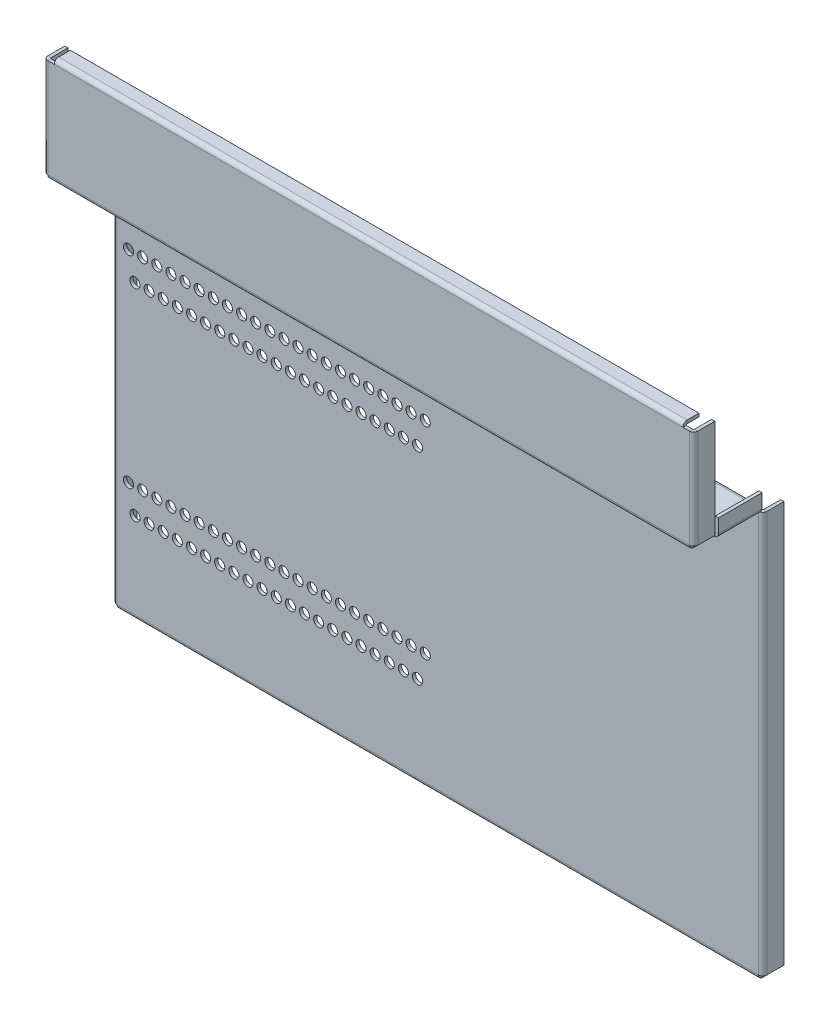
from build123d import *

# Parameters (mm, degrees)
SKETCH1_W                    = 634.26086
SKETCH1_H                    = 97.75444
BASE_FLANGE1_DEPTH           = 3.175
EDGE_FLANGE1_DEPTH           = 621.56086
EDGE_FLANGE2_DEPTH           = 97.75444
EDGE_FLANGE2_BEND_DEPTH      = 97.75444
EDGE_FLANGE3_DEPTH           = 634.26086
EDGE_FLANGE4_STRIP_W         = 14.7
EDGE_FLANGE4_STRIP_H         = 3.175
EDGE_FLANGE4_STRIP_CUT_DEPTH = 634.26086
EDGE_FLANGE4_DEPTH           = 634.26086
EDGE_FLANGE5_DEPTH           = 634.26086
EDGE_FLANGE6_DEPTH           = 397.01292
EDGE_FLANGE6_BEND_DEPTH      = 397.01292
EDGE_FLANGE7_DEPTH           = 43.19346
EDGE_FLANGE7_BEND_DEPTH      = 43.19346
CUT_EXTRUDE2_DEPTH           = 562.608451945
CUT_EXTRUDE2_DEPTH_BACK      = 562.608451945
SKETCH40_R                   = 5


# Sheet-metal steps are written as plain solids
with BuildPart() as part:
    # Sketch1 → Base-Flange1 (new body)
    with BuildSketch(Plane.XY):
        Rectangle(SKETCH1_W, SKETCH1_H)
    extrude(amount=-BASE_FLANGE1_DEPTH)

    # Edge-Flange1 section (across the edge) → Edge-Flange1 (add)
    with BuildSketch(Plane(origin=(-310.78043, 49.87722, -3.175), x_dir=(0, -1, 0), z_dir=(1, 0, 0))):
        with BuildLine():
            Line((-3.175, 1), (-3.175, 12.7))
            Line((-3.175, 12.7), (0, 12.7))
            Line((0, 12.7), (0, 1))
            ThreePointArc((0, 1), (0.292893219, 0.292893219), (1, 0))
            Line((1, 0), (1, -3.175))
            ThreePointArc((1, -3.175), (-1.952170811, -1.952170811), (-3.175, 1))
        make_face()
    extrude(amount=EDGE_FLANGE1_DEPTH)

    # Edge-Flange2 section (across the edge) → Edge-Flange2 (add)
    with BuildSketch(Plane(origin=(-318.13043, -48.87722, -3.175), x_dir=(1, 0, 0), z_dir=(0, 1, 0))):
        with BuildLine():
            Line((-3.175, 1), (-3.175, 17.78))
            Line((-3.175, 17.78), (0, 17.78))
            Line((0, 17.78), (0, 1))
            ThreePointArc((0, 1), (0.292893219, 0.292893219), (1, 0))
            Line((1, 0), (1, -3.175))
            ThreePointArc((1, -3.175), (-1.952170811, -1.952170811), (-3.175, 1))
        make_face()
    extrude(amount=EDGE_FLANGE2_DEPTH)

    # Edge-Flange2 section 2 (across the edge) → Edge-Flange2 bend (add)
    with BuildSketch(Plane(origin=(318.13043, 48.87722, -3.175), x_dir=(-1, 0, 0), z_dir=(0, -1, 0))):
        with BuildLine():
            Line((-3.175, 1), (-3.175, 17.78))
            Line((-3.175, 17.78), (0, 17.78))
            Line((0, 17.78), (0, 1))
            ThreePointArc((0, 1), (0.292893219, 0.292893219), (1, 0))
            Line((1, 0), (1, -3.175))
            ThreePointArc((1, -3.175), (-1.952170811, -1.952170811), (-3.175, 1))
        make_face()
    extrude(amount=EDGE_FLANGE2_BEND_DEPTH)

    # Edge-Flange3 section (across the edge) → Edge-Flange3 (add)
    with BuildSketch(Plane(origin=(317.13043, -49.87722, -3.175), x_dir=(0, 1, 0), z_dir=(-1, 0, 0))):
        with BuildLine():
            Line((-3.175, 1), (-3.175, 68.32346))
            Line((-3.175, 68.32346), (0, 68.32346))
            Line((0, 68.32346), (0, 1))
            ThreePointArc((0, 1), (0.292893219, 0.292893219), (1, 0))
            Line((1, 0), (1, -3.175))
            ThreePointArc((1, -3.175), (-1.952170811, -1.952170811), (-3.175, 1))
        make_face()
    extrude(amount=EDGE_FLANGE3_DEPTH)

    # Edge-Flange4 strip (across the edge) → Edge-Flange4 strip cut (cut)
    with BuildSketch(Plane(origin=(-317.13043, -53.05222, -71.49846), x_dir=(0, 0, 1), z_dir=(1, 0, 0))):
        with Locations((-3.175, -1.5875)):
            Rectangle(EDGE_FLANGE4_STRIP_W, EDGE_FLANGE4_STRIP_H)
    extrude(amount=EDGE_FLANGE4_STRIP_CUT_DEPTH, mode=Mode.SUBTRACT)

    # Edge-Flange4 section (across the edge) → Edge-Flange4 (add)
    with BuildSketch(Plane(origin=(-317.13043, -53.05222, -71.49846), x_dir=(0, 0, 1), z_dir=(1, 0, 0))):
        with BuildLine():
            Line((0, 1), (0, 398.01292))
            Line((0, 398.01292), (3.175, 398.01292))
            Line((3.175, 398.01292), (3.175, 1))
            ThreePointArc((3.175, 1), (3.467893219, 0.292893219), (4.175, 0))
            Line((4.175, 0), (4.175, -3.175))
            ThreePointArc((4.175, -3.175), (1.222829189, -1.952170811), (0, 1))
        make_face()
    extrude(amount=EDGE_FLANGE4_DEPTH)

    # Edge-Flange5 section (across the edge) → Edge-Flange5 (add)
    with BuildSketch(Plane(origin=(317.13043, -452.06514, -71.49846), x_dir=(0, 1, 0), z_dir=(-1, 0, 0))):
        with BuildLine():
            Line((-3.175, 1), (-3.175, 17.78))
            Line((-3.175, 17.78), (0, 17.78))
            Line((0, 17.78), (0, 1))
            ThreePointArc((0, 1), (0.292893219, 0.292893219), (1, 0))
            Line((1, 0), (1, -3.175))
            ThreePointArc((1, -3.175), (-1.952170811, -1.952170811), (-3.175, 1))
        make_face()
    extrude(amount=EDGE_FLANGE5_DEPTH)

    # Edge-Flange6 section (across the edge) → Edge-Flange6 (add)
    with BuildSketch(Plane(origin=(-318.13043, -451.06514, -71.49846), x_dir=(1, 0, 0), z_dir=(0, 1, 0))):
        with BuildLine():
            Line((-3.175, 1), (-3.175, 17.78))
            Line((-3.175, 17.78), (0, 17.78))
            Line((0, 17.78), (0, 1))
            ThreePointArc((0, 1), (0.292893219, 0.292893219), (1, 0))
            Line((1, 0), (1, -3.175))
            ThreePointArc((1, -3.175), (-1.952170811, -1.952170811), (-3.175, 1))
        make_face()
    extrude(amount=EDGE_FLANGE6_DEPTH)

    # Edge-Flange6 section 2 (across the edge) → Edge-Flange6 bend (add)
    with BuildSketch(Plane(origin=(318.13043, -54.05222, -71.49846), x_dir=(-1, 0, 0), z_dir=(0, -1, 0))):
        with BuildLine():
            Line((-3.175, 1), (-3.175, 17.78))
            Line((-3.175, 17.78), (0, 17.78))
            Line((0, 17.78), (0, 1))
            ThreePointArc((0, 1), (0.292893219, 0.292893219), (1, 0))
            Line((1, 0), (1, -3.175))
            ThreePointArc((1, -3.175), (-1.952170811, -1.952170811), (-3.175, 1))
        make_face()
    extrude(amount=EDGE_FLANGE6_BEND_DEPTH)

    # Edge-Flange7 section (across the edge) → Edge-Flange7 (add)
    with BuildSketch(Plane(origin=(318.527305, -49.87722, -24.13), x_dir=(-1, 0, 0), z_dir=(0, 0, -1))):
        with BuildLine():
            Line((-3.175, 1), (-3.175, 14.605))
            Line((-3.175, 14.605), (0, 14.605))
            Line((0, 14.605), (0, 1))
            ThreePointArc((0, 1), (0.292893219, 0.292893219), (1, 0))
            Line((1, 0), (1.396875, 0))
            Line((1.396875, 0), (1.396875, -3.175))
            Line((1.396875, -3.175), (1, -3.175))
            ThreePointArc((1, -3.175), (-1.952170811, -1.952170811), (-3.175, 1))
        make_face()
    extrude(amount=EDGE_FLANGE7_DEPTH)

    # Edge-Flange7 section 2 (across the edge) → Edge-Flange7 bend (add)
    with BuildSketch(Plane(origin=(-318.527305, -49.87722, -67.32346), x_dir=(1, 0, 0), z_dir=(0, 0, 1))):
        with BuildLine():
            Line((-3.175, 1), (-3.175, 14.605))
            Line((-3.175, 14.605), (0, 14.605))
            Line((0, 14.605), (0, 1))
            ThreePointArc((0, 1), (0.292893219, 0.292893219), (1, 0))
            Line((1, 0), (1.396875, 0))
            Line((1.396875, 0), (1.396875, -3.175))
            Line((1.396875, -3.175), (1, -3.175))
            ThreePointArc((1, -3.175), (-1.952170811, -1.952170811), (-3.175, 1))
        make_face()
    extrude(amount=EDGE_FLANGE7_BEND_DEPTH)

    # Sketch40 → Cut-Extrude2 (cut, two sides: drawn at the far end of the back side and taken through both)
    with BuildSketch(Plane.XY.offset(-68.32346).offset(-CUT_EXTRUDE2_DEPTH_BACK)):
        with Locations(Location((-305.70043, -141.09802, 0), (0, 0, 270))):
            Circle(SKETCH40_R)
        with Locations(Location((-291.73043, -141.09802, 0), (0, 0, 270))):
            Circle(SKETCH40_R)
        with Locations(Location((-277.76043, -141.09802, 0), (0, 0, 270))):
            Circle(SKETCH40_R)
        with Locations(Location((-263.79043, -141.09802, 0), (0, 0, 270))):
            Circle(SKETCH40_R)
        with Locations(Location((-249.82043, -141.09802, 0), (0, 0, 270))):
            Circle(SKETCH40_R)
        with Locations(Location((-235.85043, -141.09802, 0), (0, 0, 270))):
            Circle(SKETCH40_R)
        with Locations(Location((-221.88043, -141.09802, 0), (0, 0, 270))):
            Circle(SKETCH40_R)
        with Locations(Location((-207.91043, -141.09802, 0), (0, 0, 270))):
            Circle(SKETCH40_R)
        with Locations(Location((-193.94043, -141.09802, 0), (0, 0, 270))):
            Circle(SKETCH40_R)
        with Locations(Location((-179.97043, -141.09802, 0), (0, 0, 270))):
            Circle(SKETCH40_R)
        with Locations(Location((-166.00043, -141.09802, 0), (0, 0, 270))):
            Circle(SKETCH40_R)
        with Locations(Location((-152.03043, -141.09802, 0), (0, 0, 270))):
            Circle(SKETCH40_R)
        with Locations(Location((-138.06043, -141.09802, 0), (0, 0, 270))):
            Circle(SKETCH40_R)
        with Locations(Location((-124.09043, -141.09802, 0), (0, 0, 270))):
            Circle(SKETCH40_R)
        with Locations(Location((-110.12043, -141.09802, 0), (0, 0, 270))):
            Circle(SKETCH40_R)
        with Locations(Location((-96.15043, -141.09802, 0), (0, 0, 270))):
            Circle(SKETCH40_R)
        with Locations(Location((-82.18043, -141.09802, 0), (0, 0, 270))):
            Circle(SKETCH40_R)
        with Locations(Location((-68.21043, -141.09802, 0), (0, 0, 270))):
            Circle(SKETCH40_R)
        with Locations(Location((-54.24043, -141.09802, 0), (0, 0, 270))):
            Circle(SKETCH40_R)
        with Locations(Location((-40.27043, -141.09802, 0), (0, 0, 270))):
            Circle(SKETCH40_R)
        with Locations(Location((-26.30043, -141.09802, 0), (0, 0, 270))):
            Circle(SKETCH40_R)
        with Locations(Location((-12.33043, -141.09802, 0), (0, 0, 270))):
            Circle(SKETCH40_R)
        with Locations(Location((-305.70043, -340.58962, 0), (0, 0, 270))):
            Circle(SKETCH40_R)
        with Locations(Location((-291.73043, -340.58962, 0), (0, 0, 270))):
            Circle(SKETCH40_R)
        with Locations(Location((-277.76043, -340.58962, 0), (0, 0, 270))):
            Circle(SKETCH40_R)
        with Locations(Location((-263.79043, -340.58962, 0), (0, 0, 270))):
            Circle(SKETCH40_R)
        with Locations(Location((-249.82043, -340.58962, 0), (0, 0, 270))):
            Circle(SKETCH40_R)
        with Locations(Location((-235.85043, -340.58962, 0), (0, 0, 270))):
            Circle(SKETCH40_R)
        with Locations(Location((-221.88043, -340.58962, 0), (0, 0, 270))):
            Circle(SKETCH40_R)
        with Locations(Location((-207.91043, -340.58962, 0), (0, 0, 270))):
            Circle(SKETCH40_R)
        with Locations(Location((-193.94043, -340.58962, 0), (0, 0, 270))):
            Circle(SKETCH40_R)
        with Locations(Location((-179.97043, -340.58962, 0), (0, 0, 270))):
            Circle(SKETCH40_R)
        with Locations(Location((-166.00043, -340.58962, 0), (0, 0, 270))):
            Circle(SKETCH40_R)
        with Locations(Location((-152.03043, -340.58962, 0), (0, 0, 270))):
            Circle(SKETCH40_R)
        with Locations(Location((-138.06043, -340.58962, 0), (0, 0, 270))):
            Circle(SKETCH40_R)
        with Locations(Location((-12.33043, -340.58962, 0), (0, 0, 270))):
            Circle(SKETCH40_R)
        with Locations(Location((-26.30043, -340.58962, 0), (0, 0, 270))):
            Circle(SKETCH40_R)
        with Locations(Location((-40.27043, -340.58962, 0), (0, 0, 270))):
            Circle(SKETCH40_R)
        with Locations(Location((-54.24043, -340.58962, 0), (0, 0, 270))):
            Circle(SKETCH40_R)
        with Locations(Location((-68.21043, -340.58962, 0), (0, 0, 270))):
            Circle(SKETCH40_R)
        with Locations(Location((-82.18043, -340.58962, 0), (0, 0, 270))):
            Circle(SKETCH40_R)
        with Locations(Location((-96.15043, -340.58962, 0), (0, 0, 270))):
            Circle(SKETCH40_R)
        with Locations(Location((-110.12043, -340.58962, 0), (0, 0, 270))):
            Circle(SKETCH40_R)
        with Locations(Location((-124.09043, -340.58962, 0), (0, 0, 270))):
            Circle(SKETCH40_R)
        with Locations(Location((-299.35043, -166.49802, 0), (0, 0, 270))):
            Circle(SKETCH40_R)
        with Locations(Location((-285.38043, -166.49802, 0), (0, 0, 270))):
            Circle(SKETCH40_R)
        with Locations(Location((-271.41043, -166.49802, 0), (0, 0, 270))):
            Circle(SKETCH40_R)
        with Locations(Location((-257.44043, -166.49802, 0), (0, 0, 270))):
            Circle(SKETCH40_R)
        with Locations(Location((-243.47043, -166.49802, 0), (0, 0, 270))):
            Circle(SKETCH40_R)
        with Locations(Location((-229.50043, -166.49802, 0), (0, 0, 270))):
            Circle(SKETCH40_R)
        with Locations(Location((-215.53043, -166.49802, 0), (0, 0, 270))):
            Circle(SKETCH40_R)
        with Locations(Location((-201.56043, -166.49802, 0), (0, 0, 270))):
            Circle(SKETCH40_R)
        with Locations(Location((-187.59043, -166.49802, 0), (0, 0, 270))):
            Circle(SKETCH40_R)
        with Locations(Location((-173.62043, -166.49802, 0), (0, 0, 270))):
            Circle(SKETCH40_R)
        with Locations(Location((-159.65043, -166.49802, 0), (0, 0, 270))):
            Circle(SKETCH40_R)
        with Locations(Location((-145.68043, -166.49802, 0), (0, 0, 270))):
            Circle(SKETCH40_R)
        with Locations(Location((-131.71043, -166.49802, 0), (0, 0, 270))):
            Circle(SKETCH40_R)
        with Locations(Location((-117.74043, -166.49802, 0), (0, 0, 270))):
            Circle(SKETCH40_R)
        with Locations(Location((-103.77043, -166.49802, 0), (0, 0, 270))):
            Circle(SKETCH40_R)
        with Locations(Location((-89.80043, -166.49802, 0), (0, 0, 270))):
            Circle(SKETCH40_R)
        with Locations(Location((-75.83043, -166.49802, 0), (0, 0, 270))):
            Circle(SKETCH40_R)
        with Locations(Location((-61.86043, -166.49802, 0), (0, 0, 270))):
            Circle(SKETCH40_R)
        with Locations(Location((-47.89043, -166.49802, 0), (0, 0, 270))):
            Circle(SKETCH40_R)
        with Locations(Location((-33.92043, -166.49802, 0), (0, 0, 270))):
            Circle(SKETCH40_R)
        with Locations(Location((-19.95043, -166.49802, 0), (0, 0, 270))):
            Circle(SKETCH40_R)
        with Locations(Location((-299.35043, -365.98962, 0), (0, 0, 270))):
            Circle(SKETCH40_R)
        with Locations(Location((-285.38043, -365.98962, 0), (0, 0, 270))):
            Circle(SKETCH40_R)
        with Locations(Location((-271.41043, -365.98962, 0), (0, 0, 270))):
            Circle(SKETCH40_R)
        with Locations(Location((-257.44043, -365.98962, 0), (0, 0, 270))):
            Circle(SKETCH40_R)
        with Locations(Location((-243.47043, -365.98962, 0), (0, 0, 270))):
            Circle(SKETCH40_R)
        with Locations(Location((-229.50043, -365.98962, 0), (0, 0, 270))):
            Circle(SKETCH40_R)
        with Locations(Location((-215.53043, -365.98962, 0), (0, 0, 270))):
            Circle(SKETCH40_R)
        with Locations(Location((-201.56043, -365.98962, 0), (0, 0, 270))):
            Circle(SKETCH40_R)
        with Locations(Location((-187.59043, -365.98962, 0), (0, 0, 270))):
            Circle(SKETCH40_R)
        with Locations(Location((-173.62043, -365.98962, 0), (0, 0, 270))):
            Circle(SKETCH40_R)
        with Locations(Location((-159.65043, -365.98962, 0), (0, 0, 270))):
            Circle(SKETCH40_R)
        with Locations(Location((-145.68043, -365.98962, 0), (0, 0, 270))):
            Circle(SKETCH40_R)
        with Locations(Location((-131.71043, -365.98962, 0), (0, 0, 270))):
            Circle(SKETCH40_R)
        with Locations(Location((-117.74043, -365.98962, 0), (0, 0, 270))):
            Circle(SKETCH40_R)
        with Locations(Location((-103.77043, -365.98962, 0), (0, 0, 270))):
            Circle(SKETCH40_R)
        with Locations(Location((-89.80043, -365.98962, 0), (0, 0, 270))):
            Circle(SKETCH40_R)
        with Locations(Location((-75.83043, -365.98962, 0), (0, 0, 270))):
            Circle(SKETCH40_R)
        with Locations(Location((-61.86043, -365.98962, 0), (0, 0, 270))):
            Circle(SKETCH40_R)
        with Locations(Location((-47.89043, -365.98962, 0), (0, 0, 270))):
            Circle(SKETCH40_R)
        with Locations(Location((-33.92043, -365.98962, 0), (0, 0, 270))):
            Circle(SKETCH40_R)
        with Locations(Location((-19.95043, -365.98962, 0), (0, 0, 270))):
            Circle(SKETCH40_R)
    extrude(amount=CUT_EXTRUDE2_DEPTH + CUT_EXTRUDE2_DEPTH_BACK, mode=Mode.SUBTRACT)


solid = part.part
